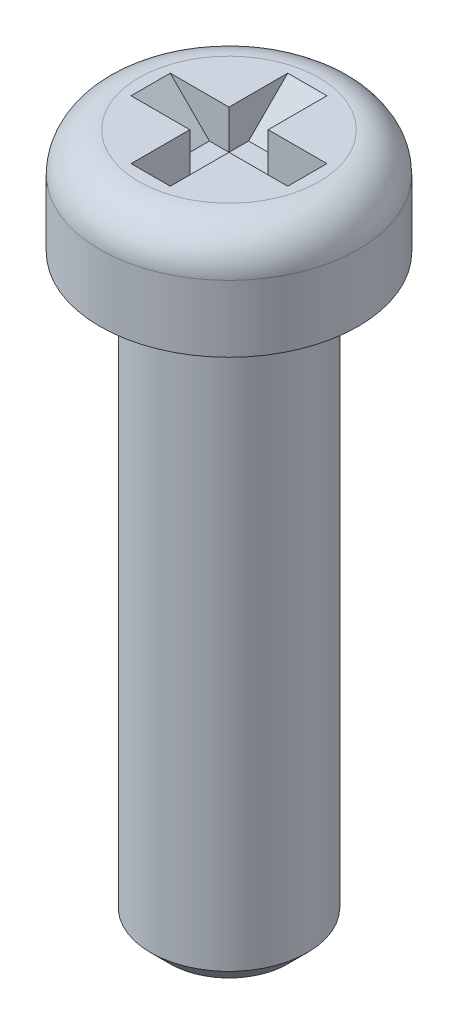
from build123d import *

# Parameters (mm, degrees)
SKETCH_1_R          = 2
EXTRUDE_1_DEPTH     = 15
SKETCH_2_R          = 3.3
EXTRUDE_2_DEPTH     = 2.7
FILLET_1_R          = 1
CHAMFER_1_SIZE      = 0.5
SKETCH_3_W          = 4
SKETCH_3_H          = 1
SKETCH_3_W_2        = 1
SKETCH_3_H_2        = 4
CUT_EXTRUDE_1_DEPTH = 1
CHAMFER_2_SIZE      = 1


with BuildPart() as part:
    # 草图1 → 凸台-拉伸1 (new body)
    with BuildSketch(Plane(origin=(0, 0, 0), x_dir=(1, 0, 0), z_dir=(0, 1, 0))):
        with Locations(Location((0, 0, 0), (0, 0, 270))):
            Circle(SKETCH_1_R)
    extrude(amount=EXTRUDE_1_DEPTH)

    # 草图2 → 凸台-拉伸2 (add)
    with BuildSketch(Plane(origin=(0, 15, 0), x_dir=(1, 0, 0), z_dir=(0, 1, 0))):
        with Locations(Location((0, 0, 0), (0, 0, 90))):
            Circle(SKETCH_2_R)
    extrude(amount=EXTRUDE_2_DEPTH)

    # 圆角1
    fillet_1_edges = [part.edges().sort_by_distance(p)[0] for p in [
        (0, 17.7, 3.3),
    ]]
    fillet(fillet_1_edges, radius=FILLET_1_R)

    # 倒角1
    chamfer_1_edges = [part.edges().sort_by_distance(p)[0] for p in [
        (0, 0, -2),
    ]]
    chamfer(chamfer_1_edges, length=CHAMFER_1_SIZE)

    # 草图3 → 切除-拉伸-薄壁1 (cut)
    with BuildSketch(Plane(origin=(0, 17.7, 0), x_dir=(1, 0, 0), z_dir=(0, 1, 0))):
        Rectangle(SKETCH_3_W, SKETCH_3_H)
        Rectangle(SKETCH_3_W_2, SKETCH_3_H_2)
    extrude(amount=-CUT_EXTRUDE_1_DEPTH, mode=Mode.SUBTRACT)

    # 倒角2
    chamfer_2_edges = [part.edges().sort_by_distance(p)[0] for p in [
        (0, 16.7, 2),
        (2, 16.7, 0),
        (0, 16.7, -2),
        (-2, 16.7, 0),
    ]]
    chamfer(chamfer_2_edges, length=CHAMFER_2_SIZE - 0.0001)  # a hair under: the kernel refuses the full size


solid = part.part
